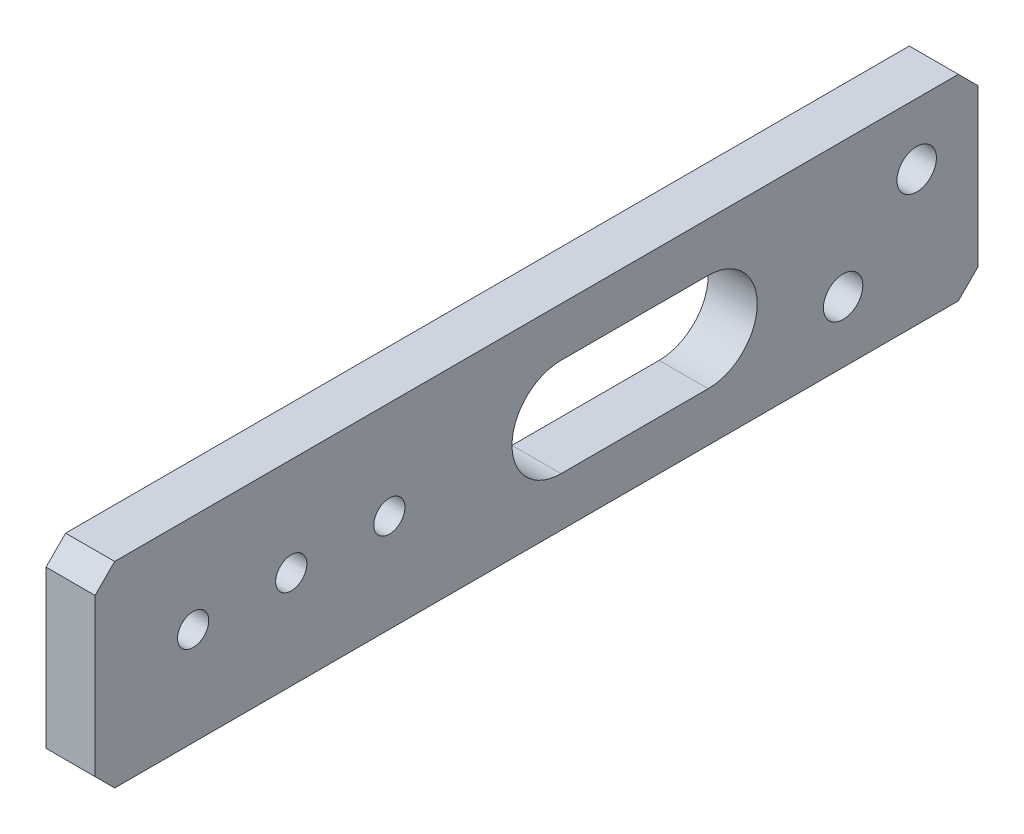
from build123d import *

# Parameters (mm, degrees)
SKETCH1_W              = 114.3
SKETCH1_H              = 25.4
BOSS_EXTRUDE1_DEPTH    = 6.35
F_10_32_TAPPED_HOLE1_D = 4.0386
F_10_CLEARANCE_HOLE1_D = 5.1054
CHAMFER1_SIZE          = 2.54
CUT_EXTRUDE1_DEPTH     = 118.260276735


with BuildPart() as part:
    # Sketch1 → Boss-Extrude1 (new body)
    with BuildSketch(Plane(origin=(0, 0, 0), x_dir=(0, 0, -1), z_dir=(1, 0, 0))):
        with Locations((57.15, 12.7)):
            Rectangle(SKETCH1_W, SKETCH1_H)
    extrude(amount=BOSS_EXTRUDE1_DEPTH)

    # #10-32 Tapped Hole1 (through all)
    with Locations(Plane(origin=(6.35, 0, 0), x_dir=(0, 0, -1), z_dir=(1, 0, 0))):
        with Locations((12.7, 12.7), (25.4, 12.7), (38.1, 12.7)):
            Hole(F_10_32_TAPPED_HOLE1_D / 2)

    # #10 Clearance Hole1 (through all)
    with Locations(Plane(origin=(6.35, 0, 0), x_dir=(0, 0, -1), z_dir=(1, 0, 0))):
        with Locations((106.3625, 17.4625), (96.8375, 7.9375)):
            Hole(F_10_CLEARANCE_HOLE1_D / 2)

    # Chamfer1
    chamfer1_edges = [part.edges().sort_by_distance(p)[0] for p in [
        (3.175, 25.4, 0),
        (3.175, 25.4, -114.3),
        (3.175, 0, -114.3),
        (3.175, 0, 0),
    ]]
    chamfer(chamfer1_edges, length=CHAMFER1_SIZE)

    # Sketch6 → Cut-Extrude1 (cut, through all)
    with BuildSketch(Plane(origin=(6.35, 0, 0), x_dir=(0, 0, -1), z_dir=(1, 0, 0))):
        with BuildLine():
            Line((79.375, 6.35), (60.325, 6.35))
            ThreePointArc((60.325, 6.35), (53.975, 12.7), (60.325, 19.05))
            Line((60.325, 19.05), (79.375, 19.05))
            ThreePointArc((79.375, 19.05), (85.725, 12.7), (79.375, 6.35))
        make_face()
    extrude(amount=-CUT_EXTRUDE1_DEPTH, mode=Mode.SUBTRACT)


solid = part.part
